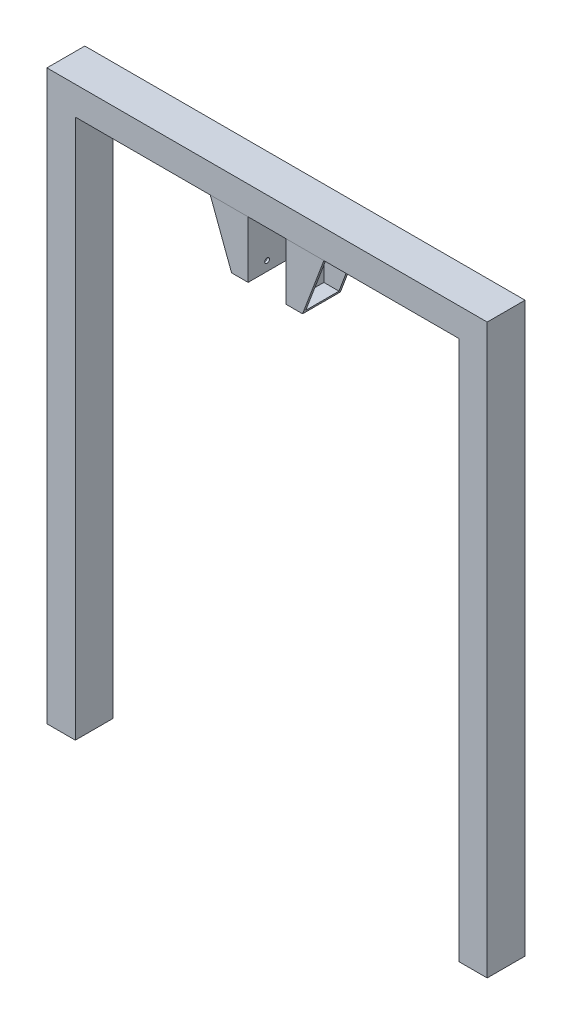
from build123d import *

# Parameters (mm, degrees)
STOCK_HULL_1_START       = 203.2
STOCK_HULL_1_OUTLINE_W   = 152.4
STOCK_HULL_1_OUTLINE_H   = 203.2
STOCK_HULL_1_DEPTH       = 3048
STOCK_HULL_1_START_2     = 3098.8
STOCK_HULL_1_2_OUTLINE_W = 2057.4
STOCK_HULL_1_2_OUTLINE_H = 203.2
STOCK_HULL_1_2_DEPTH     = 152.4
BOSS_EXTRUDE1_DEPTH      = 203.2
BOSS_EXTRUDE1_2_DEPTH    = 203.2
SHELL1_T                 = -12.7
SHELL2_T                 = -12.7
CUT_EXTRUDE1_START       = -228.6
SKETCH4_R                = 12.7
CUT_EXTRUDE1_DEPTH       = 228.6


# Read off the part's stored shape, not the designer's step: Stock-Hull-1
with BuildPart() as part:
    # Stock-Hull-1 outline → Stock-Hull-1 (new body)
    with BuildSketch(Plane(origin=(0, 0, 0), x_dir=(1, 0, 0), z_dir=(0, 1, 0)).offset(STOCK_HULL_1_START)):
        with Locations((355.6, 101.6)):
            Rectangle(STOCK_HULL_1_OUTLINE_W, STOCK_HULL_1_OUTLINE_H)
        with Locations((2565.4, 101.6)):
            Rectangle(STOCK_HULL_1_OUTLINE_W, STOCK_HULL_1_OUTLINE_H)
    extrude(amount=STOCK_HULL_1_DEPTH)

    # Stock-Hull-1 2 outline → Stock-Hull-1 2 (add)
    with BuildSketch(Plane(origin=(0, 0, 0), x_dir=(1, 0, 0), z_dir=(0, 1, 0)).offset(STOCK_HULL_1_START_2)):
        with Locations((1460.5, 101.6)):
            Rectangle(STOCK_HULL_1_2_OUTLINE_W, STOCK_HULL_1_2_OUTLINE_H)
    extrude(amount=STOCK_HULL_1_2_DEPTH)


with BuildPart() as body_2:
    # Sketch1 → Boss-Extrude1 (new body)
    with BuildSketch(Plane(origin=(0, 0, -203.2), x_dir=(-1, 0, 0), z_dir=(0, 0, -1))):
        Polygon((-1562.1, 3098.8), (-1562.1, 2794), (-1651, 2794), (-1765.3, 3098.8), align=None)
    extrude(amount=-BOSS_EXTRUDE1_DEPTH)

    # Shell1
    shell1_openings = [body_2.faces().sort_by_distance(p)[0] for p in [
        (1708.15, 2946.4, -101.6),
    ]]
    offset(amount=SHELL1_T, openings=shell1_openings, kind=Kind.INTERSECTION)


with BuildPart() as body_3:
    # Sketch1 → Boss-Extrude1 2 (new body)
    with BuildSketch(Plane(origin=(0, 0, -203.2), x_dir=(-1, 0, 0), z_dir=(0, 0, -1))):
        Polygon((-1358.9, 3098.8), (-1358.9, 2794), (-1270, 2794), (-1155.7, 3098.8), align=None)
    extrude(amount=-BOSS_EXTRUDE1_2_DEPTH)

    # Shell2
    shell2_openings = [body_3.faces().sort_by_distance(p)[0] for p in [
        (1212.85, 2946.4, -101.6),
    ]]
    offset(amount=SHELL2_T, openings=shell2_openings, kind=Kind.INTERSECTION)


with BuildPart() as cut_extrude1_tool:
    # Sketch4 → Cut-Extrude1 (new body)
    with BuildSketch(Plane.ZY.offset(-1346.2).offset(CUT_EXTRUDE1_START)):
        with Locations(Location((-101.6, 2844.8, 0), (0, 0, 270))):
            Circle(SKETCH4_R)
    extrude(amount=CUT_EXTRUDE1_DEPTH)


with BuildPart() as body_2_1:
    add(body_2.part)

    # Cut-Extrude1: cut by cut_extrude1_tool
    add(cut_extrude1_tool.part, mode=Mode.SUBTRACT)


with BuildPart() as body_3_1:
    add(body_3.part)

    # Cut-Extrude1: cut by cut_extrude1_tool
    add(cut_extrude1_tool.part, mode=Mode.SUBTRACT)


solid = Compound([part.part, body_2_1.part, body_3_1.part])
